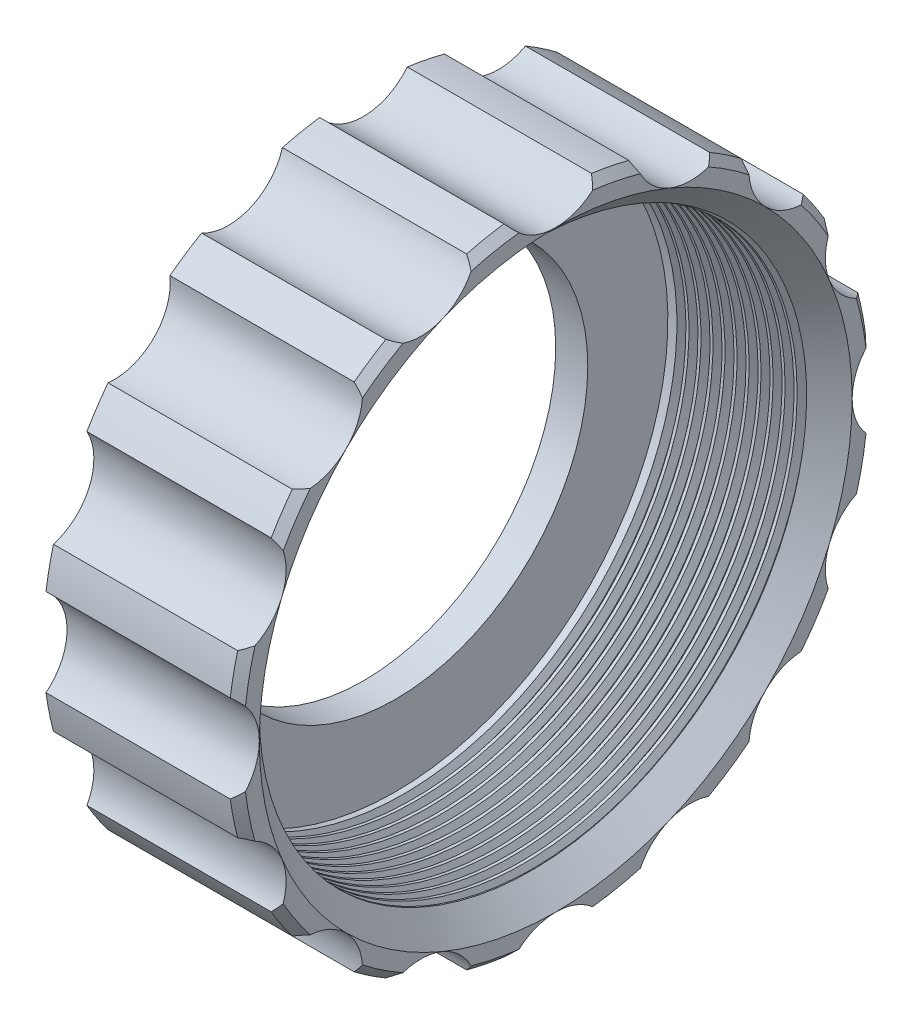
from build123d import *

# Parameters (mm, degrees)
SKETCH1_W          = 24
SKETCH1_H          = 40
SKETCH2_R          = 34
CUT_EXTRUDE1_DEPTH = 20
CHAMFER1_SIZE      = 1
CHAMFER2_SIZE      = 3
SKETCH3_R          = 24
CUT_EXTRUDE2_DEPTH = 61
THREAD2_PITCH      = 1.5
SKETCH13_R         = 7
CUT_EXTRUDE3_DEPTH = 62.449165983
CIRPATTERN1_COUNT  = 16


with BuildPart() as part:
    # Sketch1 → Revolve1 (revolve)
    with BuildSketch(Plane.XY, mode=Mode.PRIVATE) as revolve1_sk:
        with Locations((12, 20)):
            Rectangle(SKETCH1_W, SKETCH1_H)
    revolve(revolve1_sk.sketch.rotate(Axis((24, 0, 0), (-1, 0, 0)), 90), axis=Axis((24, 0, 0), (-1, 0, 0)))

    # Sketch2 → Cut-Extrude1 (cut)
    with BuildSketch(Plane(origin=(24, 0, 0), x_dir=(0, 0, -1), z_dir=(1, 0, 0))):
        Circle(SKETCH2_R)
    extrude(amount=-CUT_EXTRUDE1_DEPTH, mode=Mode.SUBTRACT)

    # Chamfer1
    chamfer1_edges = [part.edges().sort_by_distance(p)[0] for p in [
        (24, 0, 40),
    ]]
    chamfer(chamfer1_edges, length=CHAMFER1_SIZE)

    # Chamfer2
    chamfer2_edges = [part.edges().sort_by_distance(p)[0] for p in [
        (24, 0, 34),
    ]]
    chamfer(chamfer2_edges, length=CHAMFER2_SIZE)

    # Sketch3 → Cut-Extrude2 (cut, through all)
    with BuildSketch(Plane(origin=(4, 0, 0), x_dir=(0, 0, -1), z_dir=(1, 0, 0))):
        Circle(SKETCH3_R)
    extrude(amount=-CUT_EXTRUDE2_DEPTH, mode=Mode.SUBTRACT)

    # Thread2: the profile of Thread Profile3 profile screwed along a right-hand helix of 11.333333 turns, 8 arcs to a turn; built about Z, then put on its axis
    thread2_z = Axis((0, 0, 0), (0, 0, 1))
    thread2_corners = [(33.9997, 0, -0.000173205), (34.811898813, 0, 0.468749998), (34.811898813, 0, 0.656249998), (33.9997, 0, 1.125173201)]
    with BuildLine(mode=Mode.PRIVATE) as thread2_profile:
        Line(thread2_corners[0], thread2_corners[1])
        Line(thread2_corners[1], thread2_corners[2])
        Line(thread2_corners[2], thread2_corners[3])
        Line(thread2_corners[3], thread2_corners[0])
    thread2_cap = Face(thread2_profile.wire())
    thread2_turn_angles = [0, 22.5, 45, 67.5, 90, 112.5, 135, 157.5, 180, 202.5, 225, 247.5, 270, 292.5, 315, 337.5, 360]
    thread2_turn_weights = [1, 0.9238795325112867, 1, 0.9238795325112867, 1, 0.9238795325112867, 1, 0.9238795325112867, 1, 0.9238795325112867, 1, 0.9238795325112867, 1, 0.9238795325112867, 1, 0.9238795325112867, 1]
    thread2_turn_rails = [Edge.make_bspline([Vector(p[0], p[1], 0).rotate(thread2_z, thread2_turn_angles[k]) / thread2_turn_weights[k] + Vector(0, 0, p[2] + THREAD2_PITCH * thread2_turn_angles[k] / 360) for k in range(17)], [0, 0, 0, 1, 1, 2, 2, 3, 3, 4, 4, 5, 5, 6, 6, 7, 7, 8, 8, 8], 2, thread2_turn_weights) for p in thread2_corners]
    thread2_turn_sides = [Face.make_surface_from_curves(thread2_turn_rails[p[0]], thread2_turn_rails[p[1]]) for p in [(0, 1), (1, 2), (2, 3), (3, 0)]]
    thread2_last_angles = [3960, 3982.5, 4005, 4027.5, 4050, 4065, 4080]
    thread2_last_weights = [1, 0.9238795325112867, 1, 0.9238795325112867, 1, 0.9659258262890683, 1]
    thread2_last_rails = [Edge.make_bspline([Vector(p[0], p[1], 0).rotate(thread2_z, thread2_last_angles[k]) / thread2_last_weights[k] + Vector(0, 0, p[2] + THREAD2_PITCH * thread2_last_angles[k] / 360) for k in range(7)], [0, 0, 0, 1, 1, 2, 2, 3, 3, 3], 2, thread2_last_weights) for p in thread2_corners]
    thread2_last_sides = [Face.make_surface_from_curves(thread2_last_rails[p[0]], thread2_last_rails[p[1]]) for p in [(0, 1), (1, 2), (2, 3), (3, 0)]]
    thread2 = Plane(origin=(22, 0, 0), x_dir=(0, 0, 1), z_dir=(-1, 0, 0)) * Solid(Shell([*[p.moved(Location((0, 0, THREAD2_PITCH * i))) for i in range(11) for p in thread2_turn_sides], *thread2_last_sides, thread2_cap, thread2_cap.rotate(thread2_z, 4080).moved(Location((0, 0, THREAD2_PITCH * 4080 / 360)))]))
    add(thread2, mode=Mode.SUBTRACT)

    # Sketch13 → Cut-Extrude3 (cut, symmetric)
    with BuildSketch(Plane(origin=(24, 0, 0), x_dir=(0, 0, -1), z_dir=(1, 0, 0))):
        with Locations((0, 44)):
            Circle(SKETCH13_R)
    cut_extrude3 = extrude(amount=CUT_EXTRUDE3_DEPTH, both=True, mode=Mode.SUBTRACT)

    # CirPattern1: Cut-Extrude3 ×16 about axis
    cirpattern1_axis = Axis((0, 0, 0), (1, 0, 0))
    for i in range(1, CIRPATTERN1_COUNT):
        add(cut_extrude3.rotate(cirpattern1_axis, i * 360 / CIRPATTERN1_COUNT), mode=Mode.SUBTRACT)


solid = part.part
